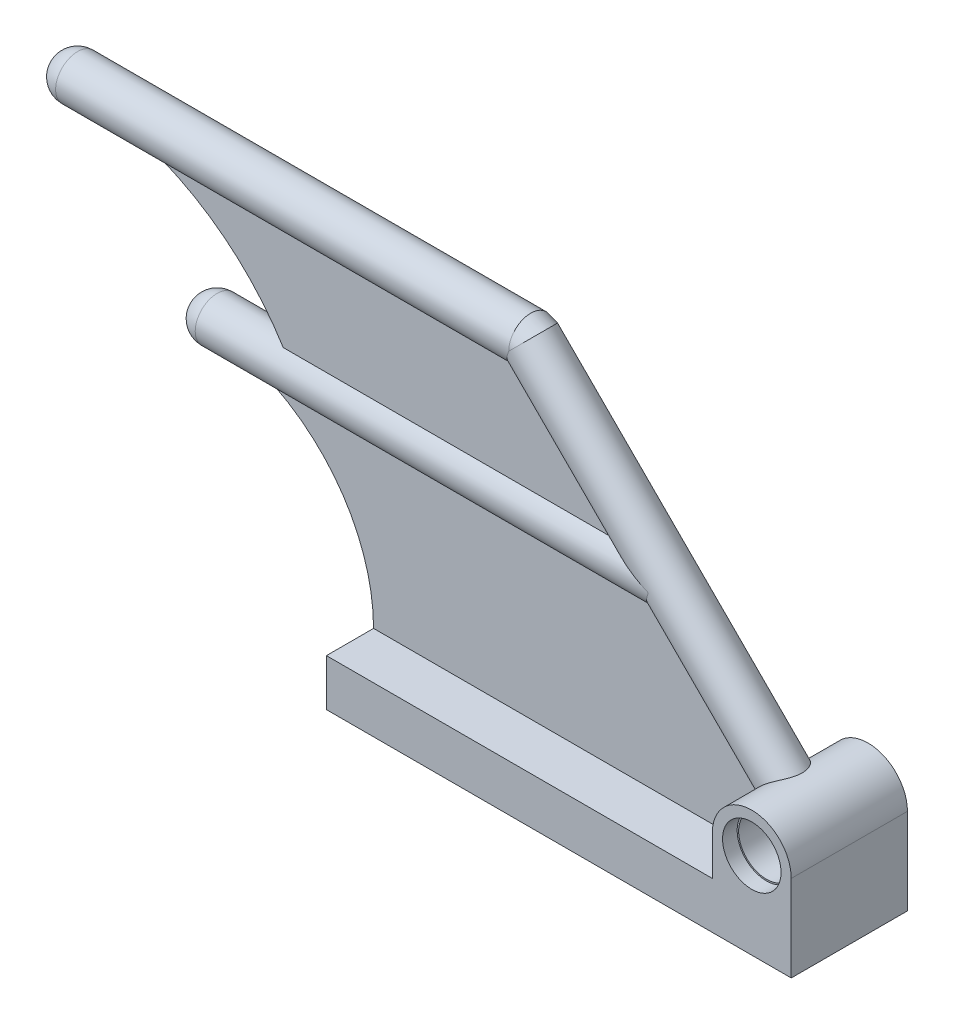
from build123d import *

# Parameters (mm, degrees)
BOSS_EXTRUDE1_DEPTH = 3.975
SKETCH2_R           = 1.9
CUT_EXTRUDE1_DEPTH  = 29.094883876
SKETCH3_R           = 2
CUT_EXTRUDE2_DEPTH  = 1
SHELL4_START        = -2.775
SHELL4_DEPTH        = 5.55
SHELL4_2_DEPTH      = 4.55
SWEEP2_PROFILE_R    = 1.5
SWEEP3_PROFILE_R    = 1.5
SWEEP4_PROFILE_R    = 1.5
DOME1_FACE_RADIUS   = 1.5
DOME1_HEIGHT        = 1.5
DOME2_FACE_RADIUS   = 1.5
DOME2_HEIGHT        = 1.5
BOSS_EXTRUDE3_DEPTH = 0.75
BOSS_EXTRUDE4_DEPTH = 0.75
SKETCH63_R          = 1.9
CUT_EXTRUDE4_DEPTH  = 55.747625576


with BuildPart() as part:
    # Sketch1 → Boss-Extrude1 (new, symmetric)
    with BuildSketch(Plane.XY):
        with BuildLine():
            Line((0, 0), (-26.4, 0))
            Line((-26.4, 0), (-26.4, -3.2))
            Line((-26.4, -3.2), (5.4, -3.2))
            Line((5.4, -3.2), (5.4, 2.7))
            ThreePointArc((5.4, 2.7), (2.7, 5.4), (0, 2.7))
            Line((0, 2.7), (0, 0))
        make_face()
    extrude(amount=BOSS_EXTRUDE1_DEPTH, both=True)

    # Sketch2 → Cut-Extrude1 (cut, through all)
    with BuildSketch(Plane.XY.offset(3.975)):
        with Locations((2.7, 2.7)):
            Circle(SKETCH2_R)
    extrude(amount=-CUT_EXTRUDE1_DEPTH, mode=Mode.SUBTRACT)

    # Sketch3 → Cut-Extrude2 (cut)
    with BuildSketch(Plane.XY.offset(3.975)):
        with Locations((2.7, 2.7)):
            Circle(SKETCH3_R)
    cut_extrude2 = extrude(amount=-CUT_EXTRUDE2_DEPTH, mode=Mode.SUBTRACT)

    # Shell4: read off the stored shape, not the designer's step
    # Shell4 outline → Shell4 (cut)
    with BuildSketch(Plane.XY.offset(SHELL4_START)):
        with BuildLine():
            Line((1.2, -0.126658805), (1.2, -1.2))
            Line((1.2, -1.2), (-25.2, -1.2))
            Line((-25.2, -1.2), (-25.2, -3.2))
            Line((-25.2, -3.2), (4.2, -3.2))
            Line((4.2, -3.2), (4.2, -0.126658805))
            ThreePointArc((4.2, -0.126658805), (2.7, -0.5), (1.2, -0.126658805))
        make_face()
    extrude(amount=SHELL4_DEPTH, mode=Mode.SUBTRACT)

    # Shell4 2 outline → Shell4 2 (cut)
    with BuildSketch(Plane.XY.offset(SHELL4_START)):
        with BuildLine():
            Line((1.2, -0.012931993), (1.2, -0.126658805))
            ThreePointArc((1.2, -0.126658805), (2.7, -0.5), (4.2, -0.126658805))
            Line((4.2, -0.126658805), (4.2, -0.012931993))
            ThreePointArc((4.2, -0.012931993), (2.7, -0.4), (1.2, -0.012931993))
        make_face()
    extrude(amount=SHELL4_2_DEPTH, mode=Mode.SUBTRACT)

    # Sweep2: sweep along a path in Sketch14
    with BuildLine(Plane.XY) as sweep2_path:
        Line((2.7, 2.7), (-16.4, 21.8))
    # Sweep2 profile (on start of the path) → Sweep2 (sweep)
    with BuildSketch(Plane(origin=(2.7, 2.7, 0), x_dir=(0.7071067811865488, 0.7071067811865464, 0), z_dir=(-0.7071067811865464, 0.7071067811865488, 0))):
        Circle(SWEEP2_PROFILE_R)
    sweep(path=sweep2_path.line)

    # Mirror1: Cut-Extrude2 across plane
    add(cut_extrude2.mirror(Plane.XY), mode=Mode.SUBTRACT)

    # Sweep3: sweep along a path in Sketch25
    with BuildLine(Plane.XY) as sweep3_path:
        Line((-16.4, 21.8), (-47.4, 21.8))
    # Sweep3 profile (on start of the path) → Sweep3 (sweep)
    with BuildSketch(Plane(origin=(-16.4, 21.8, 0), x_dir=(0, 0, -1), z_dir=(-1, 0, 0))):
        Circle(SWEEP3_PROFILE_R)
    sweep(path=sweep3_path.line)

    # Loft1: read off the stored shape, not the designer's step
    # Loft1: loft between two sections, ruled curve by curve
    loft1_from = [
        Edge.make_bspline([(-16.4, 21.8, -1.5), (-16.4, 21.925, -1.5), (-16.4, 22.0664, -1.4848), (-16.4, 22.3736, -1.3952), (-16.4, 22.54, -1.32), (-16.4, 22.86, -1.08), (-16.4, 23.012802768, -0.91349481), (-16.4, 23.234256055, -0.498269896), (-16.4, 23.3, -0.25), (-16.4, 23.3, 0.25), (-16.4, 23.234256055, 0.498269896), (-16.4, 23.012802768, 0.91349481), (-16.4, 22.86, 1.08), (-16.4, 22.54, 1.32), (-16.4, 22.3736, 1.3952), (-16.4, 22.0664, 1.4848), (-16.4, 21.925, 1.5), (-16.4, 21.8, 1.5)], [0, 0, 0, 0, 0.125, 0.125, 0.25, 0.25, 0.375, 0.375, 0.5, 0.5, 0.625, 0.625, 0.75, 0.75, 0.875, 0.875, 1, 1, 1, 1], 3),
        Edge.make_line((-16.4, 21.8, 1.5), (-16.4, 21.8, -1.5)),
    ]
    loft1_to = [
        Edge.make_bspline([(-16.4, 21.8, -1.5), (-16.311611652, 21.888388348, -1.5), (-16.211626753, 21.988373247, -1.4848), (-15.99440355, 22.20559645, -1.3952), (-15.876740982, 22.323259018, -1.32), (-15.650466812, 22.549533188, -1.08), (-15.542418938, 22.657581062, -0.91349481), (-15.385827817, 22.814172183, -0.498269896), (-15.339339828, 22.860660172, -0.25), (-15.339339828, 22.860660172, 0.25), (-15.385827817, 22.814172183, 0.498269896), (-15.542418938, 22.657581062, 0.91349481), (-15.650466812, 22.549533188, 1.08), (-15.876740982, 22.323259018, 1.32), (-15.99440355, 22.20559645, 1.3952), (-16.211626753, 21.988373247, 1.4848), (-16.311611652, 21.888388348, 1.5), (-16.4, 21.8, 1.5)], [0, 0, 0, 0, 0.125, 0.125, 0.25, 0.25, 0.375, 0.375, 0.5, 0.5, 0.625, 0.625, 0.75, 0.75, 0.875, 0.875, 1, 1, 1, 1], 3),
        Edge.make_line((-16.4, 21.8, 1.5), (-16.4, 21.8, -1.5)),
    ]
    loft1 = Solid(Shell([*[Face.make_surface_from_curves(loft1_from[k], loft1_to[k]) for k in range(2)], Face(Wire(loft1_from)), Face(Wire(loft1_to))]))
    add(loft1)

    # Sweep4: sweep along a path in Sketch40
    with BuildLine(Plane.XY) as sweep4_path:
        Line((-6.85, 12.25), (-37.85, 12.25))
    # Sweep4 profile (on start of the path) → Sweep4 (sweep)
    with BuildSketch(Plane(origin=(-6.85, 12.25, 0), x_dir=(0, 0, -1), z_dir=(-1, 0, 0))):
        Circle(SWEEP4_PROFILE_R)
    sweep(path=sweep4_path.line)

    # Dome1: a dome of height H over a round flat face of radius A is a cap of a sphere of radius (A * A + H * H) / (2 * H)
    dome1_r = (DOME1_FACE_RADIUS * DOME1_FACE_RADIUS + DOME1_HEIGHT * DOME1_HEIGHT) / (2 * DOME1_HEIGHT)
    dome1_base = Plane((-47.4, 21.8, 0), z_dir=(-1, 0, 0))
    with Locations(dome1_base.offset(DOME1_HEIGHT - dome1_r)):
        dome1_ball = Sphere(dome1_r, mode=Mode.PRIVATE)
    add(split(dome1_ball, bisect_by=dome1_base, keep=Keep.TOP, mode=Mode.PRIVATE))

    # Dome2: a dome of height H over a round flat face of radius A is a cap of a sphere of radius (A * A + H * H) / (2 * H)
    dome2_r = (DOME2_FACE_RADIUS * DOME2_FACE_RADIUS + DOME2_HEIGHT * DOME2_HEIGHT) / (2 * DOME2_HEIGHT)
    dome2_base = Plane((-37.85, 12.25, 0), z_dir=(-1, 0, 0))
    with Locations(dome2_base.offset(DOME2_HEIGHT - dome2_r)):
        dome2_ball = Sphere(dome2_r, mode=Mode.PRIVATE)
    add(split(dome2_ball, bisect_by=dome2_base, keep=Keep.TOP, mode=Mode.PRIVATE))

    # Sketch53 → Boss-Extrude3 (add, symmetric)
    with BuildSketch(Plane.XY):
        with BuildLine():
            Line((0, 0), (0, 5.4))
            Line((0, 5.4), (-6.85, 12.25))
            Line((-6.85, 12.25), (-37.85, 12.25))
            ThreePointArc((-37.85, 12.25), (-29.708179083, 8.383987715), (-26.4, 0))
            Line((-26.4, 0), (0, 0))
        make_face()
    extrude(amount=BOSS_EXTRUDE3_DEPTH, both=True)

    # Sketch54 → Boss-Extrude4 (add, symmetric)
    with BuildSketch(Plane.XY):
        with BuildLine():
            Line((-6.85, 12.25), (-16.4, 21.8))
            Line((-16.4, 21.8), (-47.4, 21.8))
            ThreePointArc((-47.4, 21.8), (-38.275787705, 19.221884941), (-31.85, 12.25))
            Line((-31.85, 12.25), (-6.85, 12.25))
        make_face()
    extrude(amount=BOSS_EXTRUDE4_DEPTH, both=True)

    # Sketch63 → Cut-Extrude4 (cut, through all)
    with BuildSketch(Plane.XY.offset(3.975)):
        with Locations((2.7, 2.7)):
            Circle(SKETCH63_R)
    extrude(amount=-CUT_EXTRUDE4_DEPTH, mode=Mode.SUBTRACT)


solid = part.part
